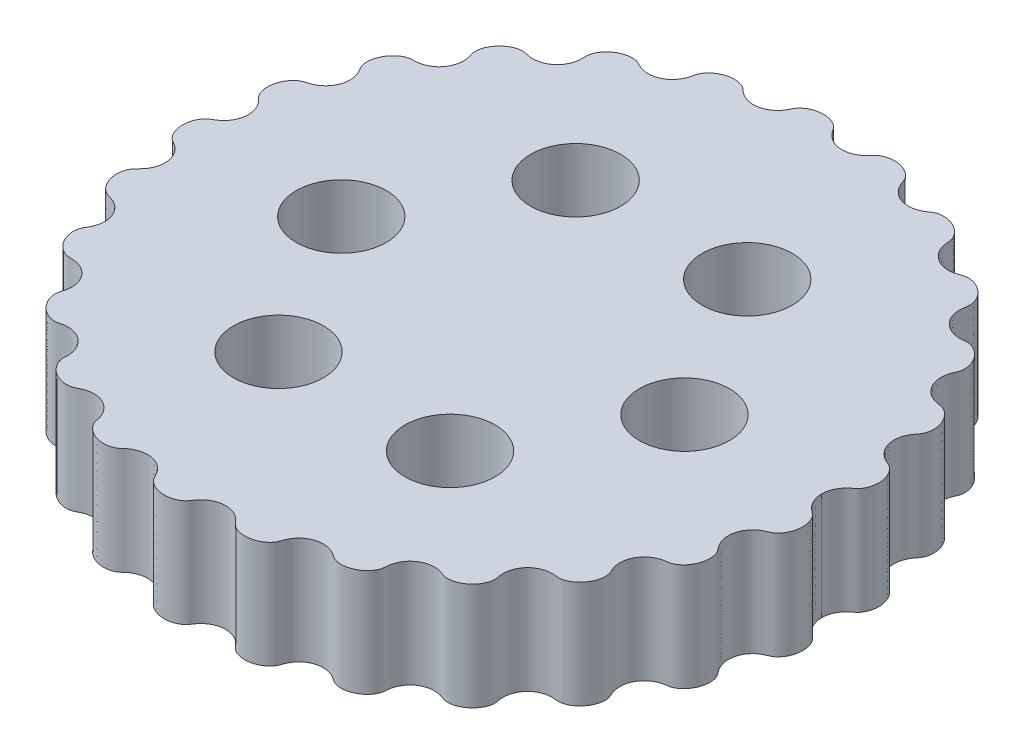
from build123d import *

# Parameters (mm, degrees)
BOSS_EXTRUDE1_DEPTH = 5
SKETCH6_R           = 2.1
CUT_EXTRUDE1_DEPTH  = 23.326267879


with BuildPart() as part:
    # Sketch4 → Boss-Extrude1 (new body)
    with BuildSketch(Plane(origin=(0, 0, 0), x_dir=(1, 0, 0), z_dir=(0, 1, 0))):
        with BuildLine():
            add(Edge.make_bspline(
                [(14.4, -1.7e-08), (14.400000001, -0.0179639), (14.400999326, -0.054155777), (14.405496287, -0.123245559), (14.417452602, -0.205733746), (14.435300791, -0.284760882), (14.458936204, -0.363829837), (14.495530725, -0.460103313), (14.553831759, -0.577672696), (14.628963289, -0.69047521), (14.720523738, -0.795156227), (14.809877944, -0.878529693), (14.885972405, -0.939710303), (14.965266318, -0.996877198), (15.039390344, -1.060755701), (15.1018131, -1.136526898), (15.154322653, -1.219306582), (15.208602449, -1.329232807), (15.256294529, -1.468797205), (15.288097075, -1.638083714), (15.294503435, -1.881017908), (15.252298066, -2.119867927), (15.1637602, -2.344380176), (15.042398564, -2.523140053), (14.94245441, -2.628650556), (14.845312037, -2.703603754), (14.757199484, -2.75037115), (14.664408662, -2.78673234), (14.573413237, -2.82696583), (14.463622, -2.885730196), (14.308968626, -2.990239544), (14.130503947, -3.16584475), (13.972147755, -3.434992937), (13.893985859, -3.773342013), (13.916927854, -4.080338903), (13.995171358, -4.310200435), (14.082412523, -4.468542002), (14.150259665, -4.567703689), (14.210026022, -4.642870296), (14.270573861, -4.71764915), (14.320176524, -4.800200553), (14.365416999, -4.910918986), (14.399338679, -5.049561592), (14.416852444, -5.262398457), (14.384340319, -5.500937501), (14.304056267, -5.731023407), (14.177986382, -5.941781709), (14.047854596, -6.095731652), (13.910789393, -6.208565653), (13.777137, -6.284416223), (13.654566629, -6.325933754), (13.550560187, -6.341335355), (13.446683903, -6.3556153), (13.344146149, -6.378219341), (13.218559064, -6.41641266), (13.049118236, -6.490187834), (12.850381491, -6.623876998), (12.649361944, -6.848376695), (12.506075667, -7.152262029), (12.46299874, -7.451003022), (12.48997225, -7.692058438), (12.539204983, -7.862350568), (12.580286972, -7.968000481), (12.61827015, -8.050352836), (12.654435799, -8.133644595), (12.678284114, -8.221362507), (12.692938305, -8.335981059), (12.690656028, -8.476153329), (12.654303526, -8.685493417), (12.545224195, -8.951239022), (12.373057401, -9.183722777), (12.149188843, -9.366304652), (11.953264529, -9.463318251), (11.811586608, -9.506241365), (11.686731924, -9.522483898), (11.583489038, -9.516968798), (11.481158628, -9.503432871), (11.378198979, -9.496859129), (11.274929533, -9.49821253), (11.172138776, -9.508022559), (11.008490275, -9.538189761), (10.791018404, -9.615836429), (10.54376529, -9.778692316), (10.34743423, -10.024278389), (10.240209593, -10.268607463), (10.194326114, -10.484243722), (10.185348079, -10.638429773), (10.193137048, -10.770510357), (10.209146619, -10.879533579), (10.225593647, -10.966240376), (10.235972878, -11.053921942), (10.233096763, -11.14231166), (10.215769233, -11.253426311), (10.176716251, -11.384209832), (10.088557736, -11.571773142), (9.914555517, -11.80057082), (9.643929478, -12.015790507), (9.33839426, -12.131431699), (9.092328835, -12.151919768), (8.938831877, -12.124722566), (8.874148355, -12.104917771), (8.823297244, -12.086266884), (8.760022234, -12.062210605), (8.657742963, -12.026792772), (8.512709046, -11.991319856), (8.295428716, -11.97104487), (8.023342576, -12.005783733), (7.739745939, -12.120021547), (7.477486579, -12.330308867), (7.309271702, -12.575786337), (7.227746068, -12.796402082), (7.194848084, -12.964652493), (7.183073794, -13.072923178), (7.177410554, -13.159952383), (7.163856527, -13.268191929), (7.120744622, -13.396146755), (7.043212114, -13.535732471), (6.896275926, -13.715388959), (6.667818283, -13.89629663), (6.347779416, -14.03871354), (6.019985541, -14.072734254), (5.761855576, -14.02689028), (5.598538488, -13.943823846), (5.51263691, -13.880075594), (5.401773626, -13.805681561), (5.259872152, -13.730304744), (5.052431839, -13.656485887), (4.77382746, -13.622953802), (4.462559435, -13.668320901), (4.188839384, -13.799904766), (3.991155398, -13.966548556), (3.857834317, -14.133926182), (3.782595695, -14.263163579), (3.730895704, -14.379947275), (3.69592382, -14.480038293), (3.66890374, -14.560561388), (3.625076907, -14.657311225), (3.549396441, -14.764707573), (3.439983046, -14.875187043), (3.255658106, -15.006023513), (2.992827177, -15.120144537), (2.651469442, -15.175704124), (2.340641018, -15.129056772), (2.125825197, -15.033765751), (2.01095266, -14.946775313), (1.969759934, -14.909017976), (1.93173959, -14.868053237), (1.895416474, -14.825543703), (1.849863622, -14.772584759), (1.773476377, -14.691024569), (1.657607797, -14.589330316), (1.467716761, -14.468702888), (1.201270806, -14.374830177), (0.894276628, -14.351781894), (0.570473221, -14.423577347), (0.317305974, -14.563244823), (0.151544702, -14.714094802), (0.048135706, -14.841769091), (-0.011407021, -14.928873544), (-0.056990631, -15.000050076), (-0.120513002, -15.08451769), (-0.216680124, -15.17111797), (-0.345491256, -15.252082884), (-0.548377405, -15.335585005), (-0.81276796, -15.385413202), (-1.083980155, -15.372591783), (-1.344979223, -15.297229029), (-1.543453081, -15.192188779), (-1.665764344, -15.097632071), (-1.75466994, -15.002005407), (-1.811224121, -14.912766255), (-1.848284502, -14.836853618), (-1.894839675, -14.742231122), (-1.981132458, -14.596441466), (-2.13046103, -14.415292593), (-2.371747135, -14.237403751), (-2.694146148, -14.1243046), (-3.005807294, -14.112083152), (-3.279802301, -14.174238455), (-3.481365526, -14.271329208), (-3.607737697, -14.358113139), (-3.692850209, -14.429558471), (-3.744273365, -14.476277951), (-3.785483991, -14.51360362), (-3.839036679, -14.557816921), (-3.971847461, -14.642561857), (-4.209211572, -14.716336999), (-4.537869609, -14.723206654), (-4.870972645, -14.623310507), (-5.119164114, -14.47411432), (-5.2872023, -14.316128509), (-5.381818777, -14.188750023), (-5.441586215, -14.068625499), (-5.469753991, -13.963937415), (-5.486204747, -13.878819236), (-5.51061517, -13.773376806), (-5.562785462, -13.611202495), (-5.668639681, -13.402851328), (-5.861501297, -13.180791236), (-6.140857489, -13.003605973), (-6.43238862, -12.920479784), (-6.707046662, -12.913936155), (-6.924586995, -12.957969238), (-7.070502232, -13.011927214), (-7.171892303, -13.061227573), (-7.234172135, -13.094294611), (-7.284237914, -13.120336964), (-7.348454125, -13.149383316), (-7.450392524, -13.181306111), (-7.592859739, -13.199325385), (-7.822504011, -13.187514265), (-8.108178823, -13.101882567), (-8.36069964, -12.948082275), (-8.564054209, -12.739258126), (-8.686860003, -12.541026141), (-8.745858699, -12.391334276), (-8.77113907, -12.257945677), (-8.769723267, -12.148159078), (-8.764488503, -12.06060027), (-8.763283534, -11.951025483), (-8.773134178, -11.82121258), (-8.801859137, -11.673190068), (-8.872937365, -11.471740845), (-9.004528254, -11.249999199), (-9.22049795, -11.035107196), (-9.499737738, -10.890462442), (-9.747533452, -10.836885462), (-9.938295916, -10.832213667), (-10.067515035, -10.843724725), (-10.169837278, -10.860858085), (-10.270401153, -10.885916097), (-10.371724701, -10.908895919), (-10.499540628, -10.914403623), (-10.649899213, -10.893032579), (-10.864421843, -10.823595982), (-11.115446738, -10.670180022), (-11.318488106, -10.46080572), (-11.461426457, -10.211875885), (-11.524752714, -10.013392151), (-11.546391671, -9.877678194), (-11.548709835, -9.764594358), (-11.539339854, -9.676135336), (-11.516898322, -9.590207442), (-11.489593068, -9.50576497), (-11.460576376, -9.39879153), (-11.437115881, -9.267755501), (-11.428038444, -9.112624579), (-11.448899273, -8.891732892), (-11.525306355, -8.644379442), (-11.680559797, -8.391694815), (-11.908334962, -8.189293006), (-12.146089512, -8.066432294), (-12.351540723, -8.011178916), (-12.509041108, -7.991840175), (-12.640826513, -7.989461218), (-12.746563832, -7.988166909), (-12.874375573, -7.9638286), (-13.017764329, -7.905880475), (-13.169248965, -7.811412503), (-13.319017823, -7.674675151), (-13.471981481, -7.480515416), (-13.581458638, -7.260884164), (-13.644013249, -7.026575852), (-13.652860905, -6.812940483), (-13.636539192, -6.672850871), (-13.606445536, -6.560514782), (-13.570431174, -6.476446714), (-13.523165972, -6.398238245), (-13.475169426, -6.320638538), (-13.421523052, -6.219949406), (-13.352206464, -6.055610198), (-13.29722316, -5.81780624), (-13.306143965, -5.511232379), (-13.418270819, -5.185793038), (-13.599550695, -4.93728619), (-13.788421679, -4.782571213), (-13.950444323, -4.693123203), (-14.068010578, -4.644082106), (-14.164678216, -4.612082102), (-14.263358735, -4.586969006), (-14.360622611, -4.556204334), (-14.472064505, -4.49721395), (-14.590574792, -4.405388416), (-14.741515619, -4.240877376), (-14.885567708, -3.98404055), (-14.960547252, -3.700014104), (-14.96247696, -3.409357531), (-14.917122555, -3.199365653), (-14.864866144, -3.065551057), (-14.804762426, -2.961268499), (-14.743749543, -2.885986355), (-14.673498554, -2.819366755), (-14.604759909, -2.751454728), (-14.541077435, -2.678635812), (-14.482882307, -2.601337069), (-14.398435021, -2.468449218), (-14.309915882, -2.267782245), (-14.257239539, -1.991630736), (-14.294765434, -1.652711694), (-14.415656613, -1.372497705), (-14.564768472, -1.180603046), (-14.70094567, -1.058517905), (-14.801501647, -0.985661639), (-14.885953427, -0.933566402), (-14.97324048, -0.886147395), (-15.055953147, -0.830915972), (-15.145345976, -0.745703154), (-15.234104555, -0.627877241), (-15.302099626, -0.497917519), (-15.35057086, -0.359470052), (-15.378415702, -0.242181118), (-15.393222627, -0.147288714), (-15.398767773, -0.063519467), (-15.399999999, -0.021213905), (-15.4, -1.594e-06)],
                knots=[0.062565796, 0.062565796, 0.062565796, 0.062565796, 0.062565796, 0.063859973, 0.06515415, 0.066448326, 0.067742503, 0.06903668, 0.070330857, 0.07291921, 0.075992333, 0.077528894, 0.079065456, 0.080602017, 0.082138578, 0.08367514, 0.085211701, 0.086753761, 0.088295822, 0.091379943, 0.094464064, 0.097548185, 0.103528845, 0.106519174, 0.109509504, 0.111075374, 0.112641243, 0.114207112, 0.115772981, 0.117338851, 0.11890472, 0.122036458, 0.127492162, 0.132947866, 0.138255082, 0.143562297, 0.146585003, 0.148096356, 0.149607709, 0.151119061, 0.152630414, 0.154141767, 0.15565312, 0.158617995, 0.161582869, 0.167512619, 0.170668106, 0.173823593, 0.17697908, 0.180134567, 0.181785014, 0.183435461, 0.185085908, 0.186736355, 0.188386802, 0.190037249, 0.193338142, 0.198333612, 0.203329082, 0.208757311, 0.21418554, 0.217038738, 0.218465337, 0.219891935, 0.221318534, 0.222745133, 0.224171732, 0.225598331, 0.22856804, 0.23153775, 0.237477169, 0.243508984, 0.246524892, 0.2495408, 0.251163787, 0.252786774, 0.254409762, 0.256032749, 0.257655736, 0.259278723, 0.26090171, 0.262524697, 0.268116353, 0.273708009, 0.279232337, 0.2819945, 0.284756664, 0.287531357, 0.288918704, 0.290306051, 0.291693397, 0.293080744, 0.294468091, 0.295855437, 0.298751953, 0.301648468, 0.307441499, 0.313806246, 0.320170993, 0.321874543, 0.322726318, 0.323578093, 0.324429868, 0.325281643, 0.326985192, 0.330392292, 0.333799391, 0.338941908, 0.344084424, 0.349371027, 0.354657629, 0.357399899, 0.358771034, 0.360142168, 0.361513303, 0.362884438, 0.365626708, 0.368571539, 0.37151637, 0.377406032, 0.383827609, 0.390249186, 0.391929851, 0.393610516, 0.39529118, 0.396971845, 0.400333174, 0.403694503, 0.409075747, 0.41445699, 0.419832854, 0.422520785, 0.425208717, 0.427878342, 0.429213155, 0.430547968, 0.431882781, 0.433217593, 0.435887219, 0.438758038, 0.441628857, 0.447370496, 0.453780785, 0.460191075, 0.461070296, 0.461949517, 0.462828738, 0.463707959, 0.46458718, 0.465466401, 0.467224842, 0.470741726, 0.47425861, 0.479541903, 0.484825197, 0.489835983, 0.494846769, 0.497503724, 0.498832202, 0.500160679, 0.501489157, 0.502817634, 0.505474589, 0.508247059, 0.511019529, 0.516564468, 0.52227034, 0.525123276, 0.527976212, 0.530631288, 0.531958826, 0.533286364, 0.534613902, 0.53594144, 0.538596516, 0.543936045, 0.549275574, 0.554531257, 0.559786941, 0.563284399, 0.566781857, 0.568530587, 0.569404951, 0.570279316, 0.57115368, 0.572028045, 0.573776774, 0.580152949, 0.586529123, 0.592383377, 0.595310504, 0.598237631, 0.600962992, 0.602325673, 0.603688354, 0.605051034, 0.606413715, 0.609139076, 0.614392618, 0.619646159, 0.624660447, 0.629674735, 0.633223523, 0.636772312, 0.638546707, 0.639433904, 0.640321101, 0.641208298, 0.642095495, 0.64386989, 0.647025799, 0.650181709, 0.656493529, 0.662419511, 0.665382503, 0.668345494, 0.671104535, 0.672484055, 0.673863575, 0.675243096, 0.676622616, 0.679381657, 0.682041398, 0.68470114, 0.690020622, 0.695473381, 0.700926139, 0.704188253, 0.70581931, 0.707450368, 0.709081425, 0.710712482, 0.712343539, 0.713974596, 0.717095441, 0.720216286, 0.726457975, 0.732286917, 0.735201388, 0.738115858, 0.739511278, 0.740906697, 0.742302116, 0.743697535, 0.745092954, 0.746488373, 0.749279211, 0.752059022, 0.754838832, 0.760398454, 0.765423781, 0.770449108, 0.773768675, 0.777088241, 0.778748025, 0.780407808, 0.782067591, 0.783727374, 0.786901153, 0.790074931, 0.793248709, 0.796422487, 0.802397424, 0.805384893, 0.808372361, 0.809807963, 0.811243566, 0.812679168, 0.81411477, 0.815550372, 0.816985974, 0.819857178, 0.825317904, 0.830778629, 0.835989797, 0.841200965, 0.844404173, 0.846005778, 0.847607382, 0.849208986, 0.85081059, 0.852412194, 0.854013798, 0.857107086, 0.860200373, 0.866386948, 0.872352981, 0.875335998, 0.878319014, 0.879839881, 0.881360748, 0.882881615, 0.884402482, 0.885923349, 0.887444216, 0.888965083, 0.890485949, 0.895823145, 0.90116034, 0.906397405, 0.911634469, 0.914757263, 0.91631866, 0.917880057, 0.919441454, 0.921002851, 0.922564248, 0.924125645, 0.927182053, 0.930238461, 0.931766665, 0.933294869, 0.934823073, 0.936351308, 0.936351308, 0.936351308, 0.936351308, 0.936351308], degree=4))
            add(Edge.make_bspline(
                [(14.4, -1.7e-08), (14.4, 0.017963997), (14.400999323, 0.054155874), (14.405496281, 0.123245656), (14.417452591, 0.205733845), (14.435300775, 0.284760982), (14.458936185, 0.363829937), (14.4955307, 0.460103415), (14.553831728, 0.577672801), (14.628963253, 0.69047532), (14.720523696, 0.795156341), (14.809877897, 0.878529812), (14.885972355, 0.939710427), (14.965266265, 0.996877326), (15.039390288, 1.060755833), (15.10181304, 1.136527033), (15.154322588, 1.21930672), (15.208602379, 1.329232947), (15.256294452, 1.468797348), (15.288096989, 1.638083858), (15.294503336, 1.881018053), (15.252297954, 2.11986807), (15.163760076, 2.344380314), (15.042398431, 2.523140184), (14.942454271, 2.628650683), (14.845311894, 2.703603875), (14.757199339, 2.750371267), (14.664408514, 2.786732452), (14.573413087, 2.826965937), (14.463621848, 2.885730297), (14.308968467, 2.990239637), (14.130503779, 3.165844833), (13.972147573, 3.434993012), (13.893985659, 3.773342084), (13.916927638, 4.080338975), (13.99517113, 4.310200511), (14.082412286, 4.468542083), (14.150259423, 4.567703774), (14.210025776, 4.642870383), (14.270573611, 4.717649241), (14.32017627, 4.800200647), (14.365416739, 4.910919082), (14.399338411, 5.049561689), (14.416852165, 5.262398556), (14.384340028, 5.500937598), (14.304055963, 5.7310235), (14.177986067, 5.941781795), (14.047854273, 6.095731731), (13.910789064, 6.208565725), (13.777136668, 6.284416288), (13.654566295, 6.325933813), (13.550559851, 6.341335407), (13.446683566, 6.355615347), (13.344145812, 6.378219382), (13.218558725, 6.416412695), (13.049117892, 6.49018786), (12.850381141, 6.623877014), (12.649361581, 6.8483767), (12.506075288, 7.152262026), (12.462998345, 7.451003017), (12.489971843, 7.692058434), (12.539204567, 7.862350567), (12.58028655, 7.968000482), (12.618269724, 8.050352839), (12.654435369, 8.1336446), (12.678283679, 8.221362513), (12.692937864, 8.335981067), (12.690655579, 8.476153336), (12.654303066, 8.685493422), (12.545223721, 8.951239022), (12.373056915, 9.183722767), (12.149188347, 9.36630463), (11.953264028, 9.463318219), (11.811586105, 9.506241326), (11.68673142, 9.522483852), (11.583488535, 9.516968746), (11.481158125, 9.503432814), (11.378198476, 9.496859067), (11.27492903, 9.498212462), (11.172138272, 9.508022486), (11.00848977, 9.538189679), (10.791017895, 9.615836336), (10.543764772, 9.778692209), (10.347433699, 10.024278272), (10.24020905, 10.26860734), (10.194325559, 10.484243597), (10.185347516, 10.638429648), (10.193136478, 10.770510232), (10.209146043, 10.879533455), (10.225593066, 10.966240253), (10.235972292, 11.053921819), (10.233096174, 11.142311537), (10.215768637, 11.253426187), (10.176715648, 11.384209706), (10.088557124, 11.571773012), (9.914554892, 11.80057068), (9.643928842, 12.015790353), (9.338393618, 12.131431528), (9.092328191, 12.151919585), (8.938831235, 12.124722374), (8.874147714, 12.104917576), (8.823296604, 12.086266686), (8.760021595, 12.062210404), (8.657742326, 12.026792566), (8.512708411, 11.991319642), (8.295428082, 11.971044645), (8.02334194, 12.005783493), (7.739745297, 12.120021292), (7.477485926, 12.330308598), (7.309271036, 12.575786059), (7.227745391, 12.7964018), (7.194847398, 12.964652209), (7.183073102, 13.072922894), (7.177409857, 13.159952099), (7.163855825, 13.268191644), (7.120743913, 13.396146467), (7.043211398, 13.535732179), (6.8962752, 13.71538866), (6.667817547, 13.896296318), (6.347778672, 14.038713212), (6.019984796, 14.072733908), (5.761854834, 14.02688992), (5.59853775, 13.943823477), (5.512636175, 13.880075221), (5.401772895, 13.805681182), (5.259871426, 13.730304358), (5.052431116, 13.65648549), (4.773826739, 13.62295339), (4.462558712, 13.668320473), (4.188838653, 13.799904324), (3.991154659, 13.966548102), (3.857833569, 14.133925722), (3.78259494, 14.263163115), (3.730894943, 14.379946808), (3.695923054, 14.480037824), (3.66890297, 14.560560918), (3.625076131, 14.657310752), (3.549395659, 14.764707096), (3.439982259, 14.87518656), (3.255657311, 15.006023021), (2.992826376, 15.12014403), (2.651468639, 15.1757036), (2.340640217, 15.129056231), (2.125824401, 15.033765199), (2.010951868, 14.946774755), (1.969759145, 14.909017416), (1.931738803, 14.868052675), (1.895415689, 14.825543138), (1.84986284, 14.772584192), (1.773475599, 14.691023999), (1.657607025, 14.589329739), (1.467715995, 14.468702301), (1.201270045, 14.374829576), (0.894275868, 14.351781276), (0.570472458, 14.423576713), (0.317305203, 14.563244175), (0.151543923, 14.714094145), (0.04813492, 14.841768429), (-0.011407811, 14.928872879), (-0.056991425, 15.000049408), (-0.120513801, 15.084517019), (-0.216680927, 15.171117293), (-0.345492063, 15.252082201), (-0.548378217, 15.335584311), (-0.812768774, 15.385412494), (-1.083980969, 15.372591061), (-1.344980032, 15.297228294), (-1.543453885, 15.192188032), (-1.665765143, 15.097631318), (-1.754670735, 15.00200465), (-1.81122491, 14.912765494), (-1.848285287, 14.836852855), (-1.894840456, 14.742230357), (-1.98113323, 14.596440697), (-2.130461793, 14.415291815), (-2.371747889, 14.23740296), (-2.694146896, 14.124303792), (-3.005808041, 14.112082329), (-3.279803051, 14.174237617), (-3.481366281, 14.271328359), (-3.607738457, 14.358112283), (-3.692850973, 14.42955761), (-3.744274132, 14.476277088), (-3.785484759, 14.513602755), (-3.83903745, 14.557816053), (-3.971848236, 14.642560982), (-4.209212351, 14.716336112), (-4.537870388, 14.723205749), (-4.870973419, 14.623309584), (-5.11916488, 14.474113384), (-5.287203058, 14.316127565), (-5.381819528, 14.188749074), (-5.44158696, 14.068624547), (-5.46975473, 13.96393646), (-5.486205481, 13.878818281), (-5.510615899, 13.77337585), (-5.562786182, 13.611201536), (-5.66864039, 13.402850363), (-5.861501995, 13.180790261), (-6.140858177, 13.003604984), (-6.432389304, 12.920478779), (-6.707047346, 12.913935136), (-6.924587681, 12.957968207), (-7.070502921, 13.011926175), (-7.171892995, 13.061226529), (-7.234172828, 13.094293563), (-7.284238608, 13.120335914), (-7.348454821, 13.149382263), (-7.450393222, 13.181305052), (-7.592860438, 13.199324318), (-7.822504709, 13.187513187), (-8.108179517, 13.101881473), (-8.360700325, 12.948081167), (-8.564054883, 12.739257008), (-8.686860667, 12.541025017), (-8.745859355, 12.391333149), (-8.771139719, 12.257944548), (-8.76972391, 12.148157949), (-8.764489142, 12.060599142), (-8.763284167, 11.951024354), (-8.773134803, 11.821211451), (-8.801859755, 11.673188937), (-8.872937972, 11.471739711), (-9.004528849, 11.249998058), (-9.220498534, 11.035106043), (-9.499738314, 10.890461274), (-9.747534026, 10.836884282), (-9.93829649, 10.832212477), (-10.067515609, 10.843723528), (-10.169837853, 10.860856882), (-10.27040173, 10.885914889), (-10.371725278, 10.908894705), (-10.499541206, 10.914402403), (-10.649899789, 10.893031351), (-10.864422416, 10.823594743), (-11.115447303, 10.670178769), (-11.31848866, 10.460804456), (-11.461426998, 10.211874613), (-11.524753245, 10.013390876), (-11.546392194, 9.877676918), (-11.548710352, 9.764593082), (-11.539340366, 9.676134061), (-11.516898829, 9.590206168), (-11.489593571, 9.505763697), (-11.460576873, 9.398790259), (-11.437116372, 9.267754231), (-11.428038926, 9.112623309), (-11.448899743, 8.891731622), (-11.525306813, 8.644378167), (-11.680560241, 8.391693532), (-11.908335396, 8.189291711), (-12.146089939, 8.066430986), (-12.351541147, 8.011177597), (-12.509041531, 7.991838848), (-12.640826936, 7.989459884), (-12.746564255, 7.98816557), (-12.874375995, 7.963827254), (-13.017764748, 7.905879122), (-13.169249379, 7.811411141), (-13.319018229, 7.674673781), (-13.471981877, 7.480514038), (-13.581459023, 7.26088278), (-13.644013621, 7.026574465), (-13.652861266, 6.812939095), (-13.636539546, 6.672849485), (-13.606445884, 6.560513397), (-13.570431517, 6.476445331), (-13.523166311, 6.398236864), (-13.47516976, 6.32063716), (-13.421523381, 6.219948031), (-13.352206784, 6.055608826), (-13.297223468, 5.817804871), (-13.306144256, 5.51123101), (-13.418271093, 5.185791663), (-13.599550957, 4.937284805), (-13.788421932, 4.782569819), (-13.950444572, 4.6931218), (-14.068010823, 4.644080697), (-14.16467846, 4.612080687), (-14.263358978, 4.586967586), (-14.360622852, 4.556202909), (-14.472064743, 4.497212519), (-14.590575025, 4.405386979), (-14.741515844, 4.240875931), (-14.885567919, 3.984039098), (-14.960547448, 3.700012648), (-14.96247714, 3.409356074), (-14.917122724, 3.199364199), (-14.864866306, 3.065549606), (-14.804762583, 2.96126705), (-14.743749696, 2.88598491), (-14.673498703, 2.819365313), (-14.604760055, 2.75145329), (-14.541077577, 2.678634378), (-14.482882445, 2.601335638), (-14.398435152, 2.468447791), (-14.309916002, 2.267780823), (-14.257239645, 1.991629317), (-14.294765521, 1.652710273), (-14.415656685, 1.372496277), (-14.564768534, 1.180601611), (-14.700945726, 1.058516462), (-14.801501699, 0.985660191), (-14.885953477, 0.933564949), (-14.973240527, 0.886145938), (-15.055953191, 0.83091451), (-15.145346016, 0.745701687), (-15.234104589, 0.62787577), (-15.302099652, 0.497916044), (-15.350570879, 0.359468574), (-15.378415715, 0.242179639), (-15.393222635, 0.147287235), (-15.398767777, 0.063517987), (-15.4, 0.021212425), (-15.4, -1.594e-06)],
                knots=[0.062565796, 0.062565796, 0.062565796, 0.062565796, 0.062565796, 0.063859973, 0.06515415, 0.066448326, 0.067742503, 0.06903668, 0.070330857, 0.07291921, 0.075992333, 0.077528894, 0.079065456, 0.080602017, 0.082138578, 0.08367514, 0.085211701, 0.086753761, 0.088295822, 0.091379943, 0.094464064, 0.097548185, 0.103528845, 0.106519174, 0.109509504, 0.111075374, 0.112641243, 0.114207112, 0.115772981, 0.117338851, 0.11890472, 0.122036458, 0.127492162, 0.132947866, 0.138255082, 0.143562297, 0.146585003, 0.148096356, 0.149607709, 0.151119061, 0.152630414, 0.154141767, 0.15565312, 0.158617995, 0.161582869, 0.167512619, 0.170668106, 0.173823593, 0.17697908, 0.180134567, 0.181785014, 0.183435461, 0.185085908, 0.186736355, 0.188386802, 0.190037249, 0.193338142, 0.198333612, 0.203329082, 0.208757311, 0.21418554, 0.217038738, 0.218465337, 0.219891935, 0.221318534, 0.222745133, 0.224171732, 0.225598331, 0.22856804, 0.23153775, 0.237477169, 0.243508984, 0.246524892, 0.2495408, 0.251163787, 0.252786774, 0.254409762, 0.256032749, 0.257655736, 0.259278723, 0.26090171, 0.262524697, 0.268116353, 0.273708009, 0.279232337, 0.2819945, 0.284756664, 0.287531357, 0.288918704, 0.290306051, 0.291693397, 0.293080744, 0.294468091, 0.295855437, 0.298751953, 0.301648468, 0.307441499, 0.313806246, 0.320170993, 0.321874543, 0.322726318, 0.323578093, 0.324429868, 0.325281643, 0.326985192, 0.330392292, 0.333799391, 0.338941908, 0.344084424, 0.349371027, 0.354657629, 0.357399899, 0.358771034, 0.360142168, 0.361513303, 0.362884438, 0.365626708, 0.368571539, 0.37151637, 0.377406032, 0.383827609, 0.390249186, 0.391929851, 0.393610516, 0.39529118, 0.396971845, 0.400333174, 0.403694503, 0.409075747, 0.41445699, 0.419832854, 0.422520785, 0.425208717, 0.427878342, 0.429213155, 0.430547968, 0.431882781, 0.433217593, 0.435887219, 0.438758038, 0.441628857, 0.447370496, 0.453780785, 0.460191075, 0.461070296, 0.461949517, 0.462828738, 0.463707959, 0.46458718, 0.465466401, 0.467224842, 0.470741726, 0.47425861, 0.479541903, 0.484825197, 0.489835983, 0.494846769, 0.497503724, 0.498832202, 0.500160679, 0.501489157, 0.502817634, 0.505474589, 0.508247059, 0.511019529, 0.516564468, 0.52227034, 0.525123276, 0.527976212, 0.530631288, 0.531958826, 0.533286364, 0.534613902, 0.53594144, 0.538596516, 0.543936045, 0.549275574, 0.554531257, 0.559786941, 0.563284399, 0.566781857, 0.568530587, 0.569404951, 0.570279316, 0.57115368, 0.572028045, 0.573776774, 0.580152949, 0.586529123, 0.592383377, 0.595310504, 0.598237631, 0.600962992, 0.602325673, 0.603688354, 0.605051034, 0.606413715, 0.609139076, 0.614392618, 0.619646159, 0.624660447, 0.629674735, 0.633223523, 0.636772312, 0.638546707, 0.639433904, 0.640321101, 0.641208298, 0.642095495, 0.64386989, 0.647025799, 0.650181709, 0.656493529, 0.662419511, 0.665382503, 0.668345494, 0.671104535, 0.672484055, 0.673863575, 0.675243096, 0.676622616, 0.679381657, 0.682041398, 0.68470114, 0.690020622, 0.695473381, 0.700926139, 0.704188253, 0.70581931, 0.707450368, 0.709081425, 0.710712482, 0.712343539, 0.713974596, 0.717095441, 0.720216286, 0.726457975, 0.732286917, 0.735201388, 0.738115858, 0.739511278, 0.740906697, 0.742302116, 0.743697535, 0.745092954, 0.746488373, 0.749279211, 0.752059022, 0.754838832, 0.760398454, 0.765423781, 0.770449108, 0.773768675, 0.777088241, 0.778748025, 0.780407808, 0.782067591, 0.783727374, 0.786901153, 0.790074931, 0.793248709, 0.796422487, 0.802397424, 0.805384893, 0.808372361, 0.809807963, 0.811243566, 0.812679168, 0.81411477, 0.815550372, 0.816985974, 0.819857178, 0.825317904, 0.830778629, 0.835989797, 0.841200965, 0.844404173, 0.846005778, 0.847607382, 0.849208986, 0.85081059, 0.852412194, 0.854013798, 0.857107086, 0.860200373, 0.866386948, 0.872352981, 0.875335998, 0.878319014, 0.879839881, 0.881360748, 0.882881615, 0.884402482, 0.885923349, 0.887444216, 0.888965083, 0.890485949, 0.895823145, 0.90116034, 0.906397405, 0.911634469, 0.914757263, 0.91631866, 0.917880057, 0.919441454, 0.921002851, 0.922564248, 0.924125645, 0.927182053, 0.930238461, 0.931766665, 0.933294869, 0.934823073, 0.936351277, 0.936351277, 0.936351277, 0.936351277, 0.936351277], degree=4))
        make_face()
    extrude(amount=BOSS_EXTRUDE1_DEPTH)

    # Sketch6 → Cut-Extrude1 (cut, through all)
    with BuildSketch(Plane(origin=(0, 0, 0), x_dir=(1, 0, 0), z_dir=(0, 1, 0))):
        with Locations((8, 1.13e-07)):
            Circle(SKETCH6_R)
        with Locations((4, 6.928203343)):
            Circle(SKETCH6_R)
        with Locations((-4, 6.928203343)):
            Circle(SKETCH6_R)
        with Locations((-8, 1.13e-07)):
            Circle(SKETCH6_R)
        with Locations((-4, -6.928203117)):
            Circle(SKETCH6_R)
        with Locations((4, -6.928203117)):
            Circle(SKETCH6_R)
    extrude(amount=CUT_EXTRUDE1_DEPTH, mode=Mode.SUBTRACT)


solid = part.part
